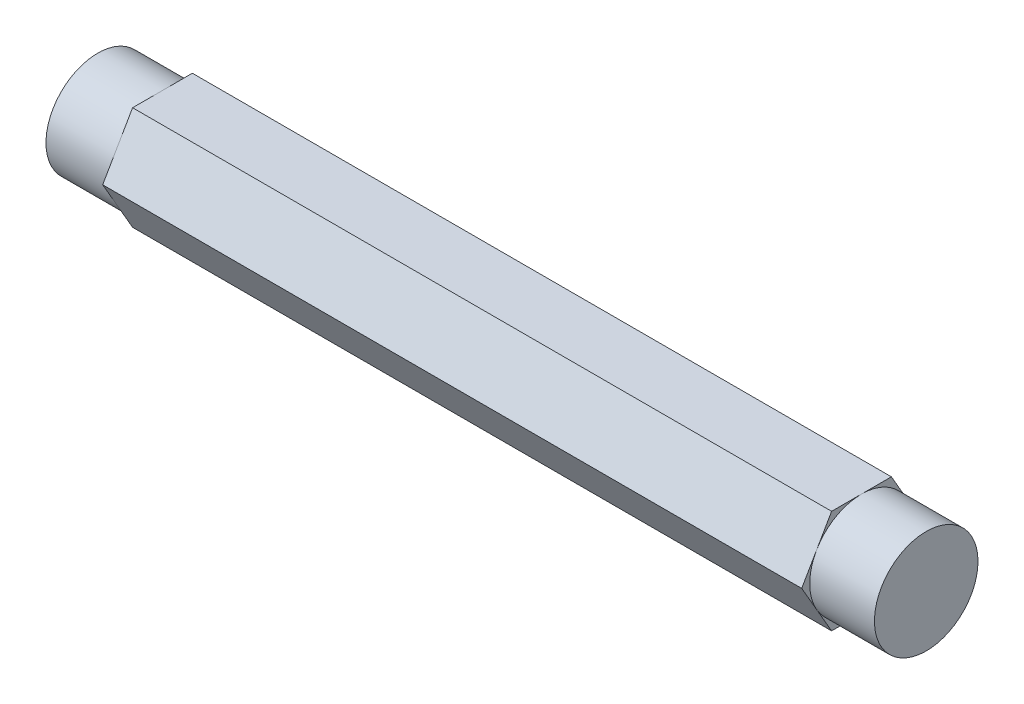
from build123d import *

# Parameters (mm, degrees)
BOSS_EXTRUDE1_DEPTH     = 50.8
SKETCH3_R               = 8.89
SKETCH3_R_2             = 6.35
CUT_EXTRUDE_THIN1_DEPTH = 7.9375


with BuildPart() as part:
    # Sketch2 → Boss-Extrude1 (new, symmetric)
    with BuildSketch(Plane(origin=(0, 0, 0), x_dir=(0, 0, -1), z_dir=(1, 0, 0))):
        Polygon((7.332348419, 0), (3.666174209, 6.35), (-3.666174209, 6.35), (-7.332348419, 0), (-3.666174209, -6.35), (3.666174209, -6.35), align=None)
    extrude(amount=BOSS_EXTRUDE1_DEPTH, both=True)

    # Sketch3 → Cut-Extrude-Thin1 (cut)
    with BuildSketch(Plane(origin=(50.8, 0, 0), x_dir=(0, 0, -1), z_dir=(1, 0, 0))):
        Circle(SKETCH3_R)
        Circle(SKETCH3_R_2, mode=Mode.SUBTRACT)
    cut_extrude_thin1 = extrude(amount=-CUT_EXTRUDE_THIN1_DEPTH, mode=Mode.SUBTRACT)

    # Mirror1: Cut-Extrude-Thin1 across plane
    add(cut_extrude_thin1.mirror(Plane(origin=(0, 0, 0), x_dir=(0, 0, 1), z_dir=(1, 0, 0))), mode=Mode.SUBTRACT)


solid = part.part
